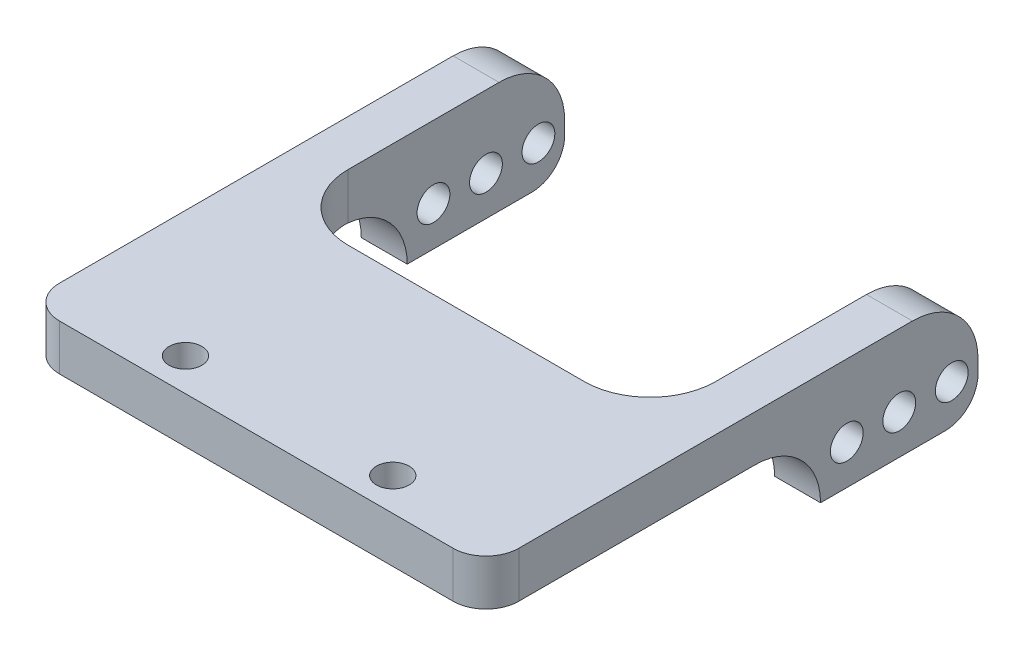
from build123d import *

# Parameters (mm, degrees)
EXTRUDE_1_DEPTH     = 7
SKETCH_2_W          = 7
SKETCH_2_H          = 24
EXTRUDE_2_DEPTH     = 10
FILLET_1_R          = 10
FILLET_2_R          = 10
SKETCH_3_R          = 2.5
CUT_EXTRUDE_1_DEPTH = 104.07764064
FILLET_3_R          = 10
FILLET_4_R          = 10
FILLET_5_R          = 10
FILLET_6_R          = 10
FILLET_8_R          = 5
FILLET_9_R          = 5
SKETCH_4_R          = 2.5
CUT_EXTRUDE_2_DEPTH = 104.077640708
SKETCH_5_R          = 2.5
CUT_EXTRUDE_3_DEPTH = 104.990384238
FILLET_10_R         = 5
FILLET_11_R         = 5


with BuildPart() as part:
    # 草图1 → 凸台-拉伸1 (new body)
    with BuildSketch(Plane(origin=(0, 0, 0), x_dir=(1, 0, 0), z_dir=(0, 1, 0))):
        Polygon((0, 0), (7, 0), (7, -43), (35, -43), (63, -43), (63, 0), (70, 0), (70, -75), (0, -75), align=None)
    extrude(amount=EXTRUDE_1_DEPTH)

    # 草图2 → 凸台-拉伸2 (add)
    with BuildSketch(Plane.XZ):
        with Locations((3.5, 12)):
            Rectangle(SKETCH_2_W, SKETCH_2_H)
        with Locations((66.5, 12)):
            Rectangle(SKETCH_2_W, SKETCH_2_H)
    extrude(amount=EXTRUDE_2_DEPTH)

    # 圆角1
    fillet_1_edges = [part.edges().sort_by_distance(p)[0] for p in [
        (3.5, 0, 24),
    ]]
    fillet(fillet_1_edges, radius=FILLET_1_R - 0.0001)  # a hair under: the kernel refuses the full size

    # 圆角2
    fillet_2_edges = [part.edges().sort_by_distance(p)[0] for p in [
        (66.5, 0, 24),
    ]]
    fillet(fillet_2_edges, radius=FILLET_2_R - 0.0001)  # a hair under: the kernel refuses the full size

    # 草图3 → 切除-拉伸1 (cut, through all)
    with BuildSketch(Plane(origin=(70, 0, 0), x_dir=(0, 0, -1), z_dir=(1, 0, 0))):
        with Locations((-12, -4)):
            Circle(SKETCH_3_R)
    extrude(amount=-CUT_EXTRUDE_1_DEPTH, mode=Mode.SUBTRACT)

    # 圆角3
    fillet_3_edges = [part.edges().sort_by_distance(p)[0] for p in [
        (3.5, 7, 0),
    ]]
    fillet(fillet_3_edges, radius=FILLET_3_R)

    # 圆角4
    fillet_4_edges = [part.edges().sort_by_distance(p)[0] for p in [
        (66.5, 7, 0),
    ]]
    fillet(fillet_4_edges, radius=FILLET_4_R)

    # 圆角5
    fillet_5_edges = [part.edges().sort_by_distance(p)[0] for p in [
        (7, 3.5, 43),
    ]]
    fillet(fillet_5_edges, radius=FILLET_5_R)

    # 圆角6
    fillet_6_edges = [part.edges().sort_by_distance(p)[0] for p in [
        (63, 3.5, 43),
    ]]
    fillet(fillet_6_edges, radius=FILLET_6_R)

    # 圆角8
    fillet_8_edges = [part.edges().sort_by_distance(p)[0] for p in [
        (66.5, -10, 0),
    ]]
    fillet(fillet_8_edges, radius=FILLET_8_R)

    # 圆角9
    fillet_9_edges = [part.edges().sort_by_distance(p)[0] for p in [
        (3.5, -10, 0),
    ]]
    fillet(fillet_9_edges, radius=FILLET_9_R)

    # 草图4 → 切除-拉伸2 (cut, through all)
    with BuildSketch(Plane(origin=(70, 0, 0), x_dir=(0, 0, -1), z_dir=(1, 0, 0))):
        with Locations((-4, -4)):
            Circle(SKETCH_4_R)
        with Locations((-20, -4)):
            Circle(SKETCH_4_R)
    extrude(amount=-CUT_EXTRUDE_2_DEPTH, mode=Mode.SUBTRACT)

    # 草图5 → 切除-拉伸3 (cut, through all)
    with BuildSketch(Plane(origin=(0, 7, 0), x_dir=(1, 0, 0), z_dir=(0, 1, 0))):
        with Locations(Location((19.2, -70, 0), (0, 0, 270))):
            Circle(SKETCH_5_R)
        with Locations(Location((50.8, -70, 0), (0, 0, 270))):
            Circle(SKETCH_5_R)
    extrude(amount=-CUT_EXTRUDE_3_DEPTH, mode=Mode.SUBTRACT)

    # 圆角10
    fillet_10_edges = [part.edges().sort_by_distance(p)[0] for p in [
        (0, 3.5, 75),
    ]]
    fillet(fillet_10_edges, radius=FILLET_10_R)

    # 圆角11
    fillet_11_edges = [part.edges().sort_by_distance(p)[0] for p in [
        (70, 3.5, 75),
    ]]
    fillet(fillet_11_edges, radius=FILLET_11_R)


solid = part.part
